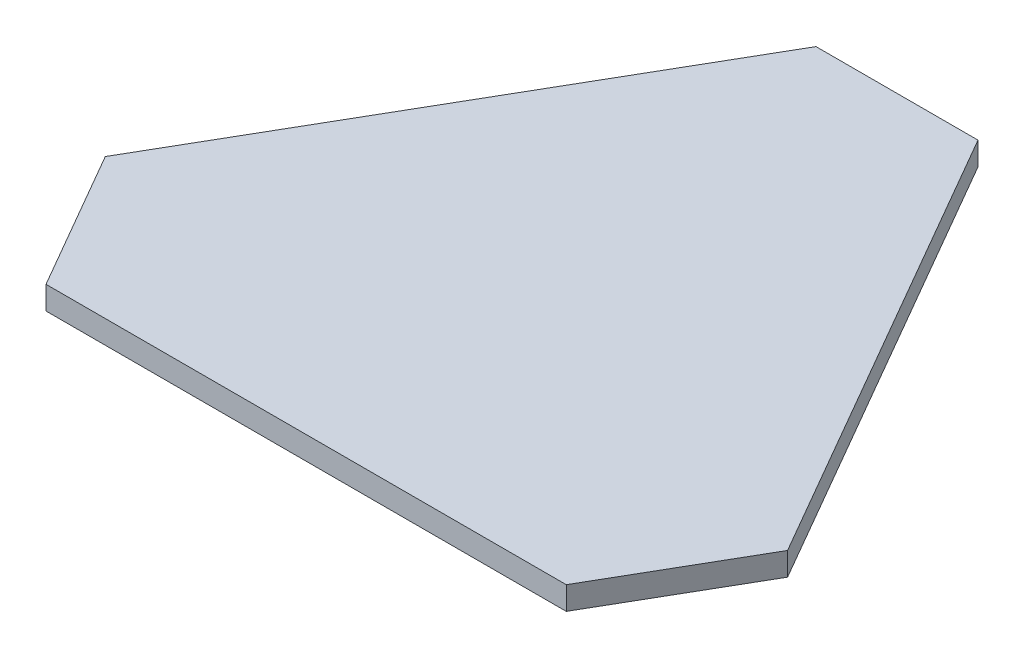
from build123d import *

# Parameters (mm, degrees)
BOSS_EXTRUDE1_DEPTH = 10


with BuildPart() as part:
    # Sketch1 → Boss-Extrude1 (new body)
    with BuildSketch(Plane(origin=(0, 0, 0), x_dir=(1, 0, 0), z_dir=(0, 1, 0))):
        Polygon((112.403810568, -105.310889132), (147.403810568, -44.689110868), (35, 150), (-35, 150), (-147.403810568, -44.689110868), (-112.403810568, -105.310889132), align=None)
    extrude(amount=BOSS_EXTRUDE1_DEPTH)


solid = part.part
